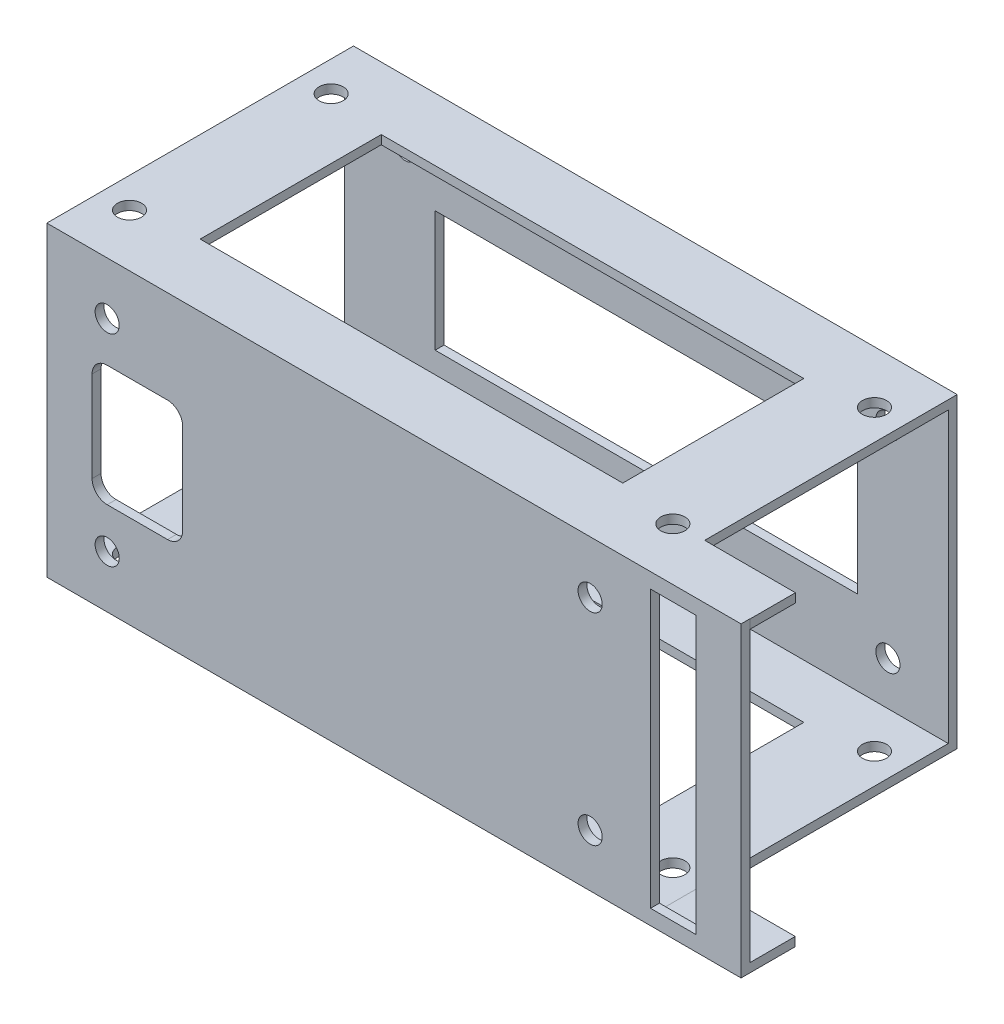
from build123d import *

# Parameters (mm, degrees)
BOSS_EXTRUDE1_START         = -2.9464
BOSS_EXTRUDE1_OUTLINE_W     = 230
BOSS_EXTRUDE1_OUTLINE_H     = 101.6
BOSS_EXTRUDE1_OUTLINE_R     = 4
BOSS_EXTRUDE1_OUTLINE_W_2   = 15
BOSS_EXTRUDE1_OUTLINE_H_2   = 91.6
BOSS_EXTRUDE1_DEPTH         = 2.9464
BOSS_EXTRUDE1_START_2       = -101.6
BOSS_EXTRUDE1_2_OUTLINE_W   = 200
BOSS_EXTRUDE1_2_OUTLINE_H   = 101.6
BOSS_EXTRUDE1_2_OUTLINE_R   = 4
BOSS_EXTRUDE1_2_OUTLINE_W_2 = 140
BOSS_EXTRUDE1_2_OUTLINE_H_2 = 40
BOSS_EXTRUDE1_2_DEPTH       = 2.9464
BOSS_EXTRUDE1_START_3       = -98.6536
BOSS_EXTRUDE1_3_OUTLINE_W   = 30
BOSS_EXTRUDE1_3_OUTLINE_H   = 2.9464
BOSS_EXTRUDE1_3_DEPTH       = 95.7072
BOSS_EXTRUDE1_4_OUTLINE_W   = 140
BOSS_EXTRUDE1_4_OUTLINE_H   = 2.9464
BOSS_EXTRUDE1_4_DEPTH       = 17.8536
BOSS_EXTRUDE1_START_4       = -20.8
BOSS_EXTRUDE1_5_OUTLINE_W   = 140
BOSS_EXTRUDE1_5_OUTLINE_H   = 2.9464
BOSS_EXTRUDE1_5_DEPTH       = 17.8536
BOSS_EXTRUDE1_START_5       = -2.95
BOSS_EXTRUDE1_6_DEPTH       = 0.0036
BOSS_EXTRUDE1_START_6       = -50.8
BOSS_EXTRUDE1_7_OUTLINE_R   = 4
BOSS_EXTRUDE1_7_DEPTH       = 101.6
SKETCH3_W                   = 30
SKETCH3_H                   = 2.95
SKETCH3_W_2                 = 30.067744433
BOSS_EXTRUDE2_DEPTH         = 15
CUT_EXTRUDE1_REACH          = 232.007
SKETCH4_W                   = 30
SKETCH4_H                   = 40
FILLET1_R                   = 5
FILLET2_R                   = 5
FILLET3_R                   = 5
FILLET4_R                   = 5


with BuildPart() as part:
    # Boss-Extrude1: read off the stored shape, not the designer's step
    # Boss-Extrude1 outline → Boss-Extrude1 (new body)
    with BuildSketch(Plane.XY.offset(50.8).offset(BOSS_EXTRUDE1_START)):
        with Locations((-85, 0)):
            Rectangle(BOSS_EXTRUDE1_OUTLINE_W, BOSS_EXTRUDE1_OUTLINE_H)
        with Locations((-20, 33.4)):
            Circle(BOSS_EXTRUDE1_OUTLINE_R, mode=Mode.SUBTRACT)
        with Locations((-180, 33.4)):
            Circle(BOSS_EXTRUDE1_OUTLINE_R, mode=Mode.SUBTRACT)
        with Locations((7.5, 0)):
            Rectangle(BOSS_EXTRUDE1_OUTLINE_W_2, BOSS_EXTRUDE1_OUTLINE_H_2, mode=Mode.SUBTRACT)
        with Locations((-180, -33.4)):
            Circle(BOSS_EXTRUDE1_OUTLINE_R, mode=Mode.SUBTRACT)
        with Locations((-20, -33.4)):
            Circle(BOSS_EXTRUDE1_OUTLINE_R, mode=Mode.SUBTRACT)
    extrude(amount=BOSS_EXTRUDE1_DEPTH)



with BuildPart() as body_2:
    # Boss-Extrude1 2 outline → Boss-Extrude1 2 (new body)
    with BuildSketch(Plane.XY.offset(50.8).offset(BOSS_EXTRUDE1_START_2)):
        with Locations((-100, 0)):
            Rectangle(BOSS_EXTRUDE1_2_OUTLINE_W, BOSS_EXTRUDE1_2_OUTLINE_H)
        with Locations((-20, 33.4)):
            Circle(BOSS_EXTRUDE1_2_OUTLINE_R, mode=Mode.SUBTRACT)
        with Locations((-180, 33.4)):
            Circle(BOSS_EXTRUDE1_2_OUTLINE_R, mode=Mode.SUBTRACT)
        with Locations((-180, -33.4)):
            Circle(BOSS_EXTRUDE1_2_OUTLINE_R, mode=Mode.SUBTRACT)
        with Locations((-100, 0)):
            Rectangle(BOSS_EXTRUDE1_2_OUTLINE_W_2, BOSS_EXTRUDE1_2_OUTLINE_H_2, mode=Mode.SUBTRACT)
        with Locations((-20, -33.4)):
            Circle(BOSS_EXTRUDE1_2_OUTLINE_R, mode=Mode.SUBTRACT)
    extrude(amount=BOSS_EXTRUDE1_2_DEPTH)


with BuildPart() as part_1:
    add(part.part)

    add(body_2.part)  # Boss-Extrude1 3 merges body 2
    # Boss-Extrude1 3 outline → Boss-Extrude1 3 (add)
    with BuildSketch(Plane.XY.offset(50.8).offset(BOSS_EXTRUDE1_START_3)):
        with Locations((-15, -49.3268)):
            Rectangle(BOSS_EXTRUDE1_3_OUTLINE_W, BOSS_EXTRUDE1_3_OUTLINE_H)
        with Locations((-185, -49.3268)):
            Rectangle(BOSS_EXTRUDE1_3_OUTLINE_W, BOSS_EXTRUDE1_3_OUTLINE_H)
        with Locations((-15, 49.3268)):
            Rectangle(BOSS_EXTRUDE1_3_OUTLINE_W, BOSS_EXTRUDE1_3_OUTLINE_H)
        with Locations((-185, 49.3268)):
            Rectangle(BOSS_EXTRUDE1_3_OUTLINE_W, BOSS_EXTRUDE1_3_OUTLINE_H)
    extrude(amount=BOSS_EXTRUDE1_3_DEPTH)

    # Boss-Extrude1 4 outline → Boss-Extrude1 4 (add)
    with BuildSketch(Plane.XY.offset(50.8).offset(BOSS_EXTRUDE1_START_3)):
        with Locations((-100, -49.3268)):
            Rectangle(BOSS_EXTRUDE1_4_OUTLINE_W, BOSS_EXTRUDE1_4_OUTLINE_H)
        with Locations((-100, 49.3268)):
            Rectangle(BOSS_EXTRUDE1_4_OUTLINE_W, BOSS_EXTRUDE1_4_OUTLINE_H)
    extrude(amount=BOSS_EXTRUDE1_4_DEPTH)

    # Boss-Extrude1 5 outline → Boss-Extrude1 5 (add)
    with BuildSketch(Plane.XY.offset(50.8).offset(BOSS_EXTRUDE1_START_4)):
        with Locations((-100, -49.3268)):
            Rectangle(BOSS_EXTRUDE1_5_OUTLINE_W, BOSS_EXTRUDE1_5_OUTLINE_H)
        with Locations((-100, 49.3268)):
            Rectangle(BOSS_EXTRUDE1_5_OUTLINE_W, BOSS_EXTRUDE1_5_OUTLINE_H)
    extrude(amount=BOSS_EXTRUDE1_5_DEPTH)

    # Boss-Extrude1 6 outline → Boss-Extrude1 6 (add)
    with BuildSketch(Plane.XY.offset(50.8).offset(BOSS_EXTRUDE1_START_5)):
        Polygon((0, -45.8), (0, -50.8), (30, -50.8), (30, 50.8), (0, 50.8), (0, 45.8), (15, 45.8), (15, -45.8), align=None)
    extrude(amount=BOSS_EXTRUDE1_6_DEPTH)

    # Boss-Extrude1 7 outline → Boss-Extrude1 7 (cut)
    with BuildSketch(Plane(origin=(0, 0, 0), x_dir=(1, 0, 0), z_dir=(0, 1, 0)).offset(BOSS_EXTRUDE1_START_6)):
        with Locations((-190, 33.4)):
            Circle(BOSS_EXTRUDE1_7_OUTLINE_R)
        with Locations((-190, -33.4)):
            Circle(BOSS_EXTRUDE1_7_OUTLINE_R)
        with Locations((-10, 33.4)):
            Circle(BOSS_EXTRUDE1_7_OUTLINE_R)
        with Locations((-10, -33.4)):
            Circle(BOSS_EXTRUDE1_7_OUTLINE_R)
    extrude(amount=BOSS_EXTRUDE1_7_DEPTH, mode=Mode.SUBTRACT)

    # Sketch3 → Boss-Extrude2 (add)
    with BuildSketch(Plane(origin=(0, 0, 47.85), x_dir=(-1, 0, 0), z_dir=(0, 0, -1))):
        with Locations((-15, -49.325)):
            Rectangle(SKETCH3_W, SKETCH3_H)
        with Locations((-15.033872217, 49.325)):
            Rectangle(SKETCH3_W_2, SKETCH3_H)
    extrude(amount=BOSS_EXTRUDE2_DEPTH)

    # Sketch4 → Cut-Extrude1 (cut, up to next)
    with BuildSketch(Plane.XY.offset(50.8), mode=Mode.PRIVATE) as cut_extrude1_sk1:
        with Locations((-170, 0)):
            Rectangle(SKETCH4_W, SKETCH4_H)
    cut_extrude1_tool1 = extrude(cut_extrude1_sk1.sketch, amount=-CUT_EXTRUDE1_REACH, mode=Mode.PRIVATE) & part_1.part
    add(cut_extrude1_tool1.solids().sort_by_distance((-170, 0, 50.8))[0], mode=Mode.SUBTRACT)

    # Fillet1
    fillet1_edges = [part_1.edges().sort_by_distance(p)[0] for p in [
        (-155, -20, 49.3268),
    ]]
    fillet(fillet1_edges, radius=FILLET1_R)

    # Fillet2
    fillet2_edges = [part_1.edges().sort_by_distance(p)[0] for p in [
        (-155, 20, 49.3268),
    ]]
    fillet(fillet2_edges, radius=FILLET2_R)

    # Fillet3
    fillet3_edges = [part_1.edges().sort_by_distance(p)[0] for p in [
        (-185, -20, 49.3268),
    ]]
    fillet(fillet3_edges, radius=FILLET3_R)

    # Fillet4
    fillet4_edges = [part_1.edges().sort_by_distance(p)[0] for p in [
        (-185, 20, 49.3268),
    ]]
    fillet(fillet4_edges, radius=FILLET4_R)


solid = part_1.part
